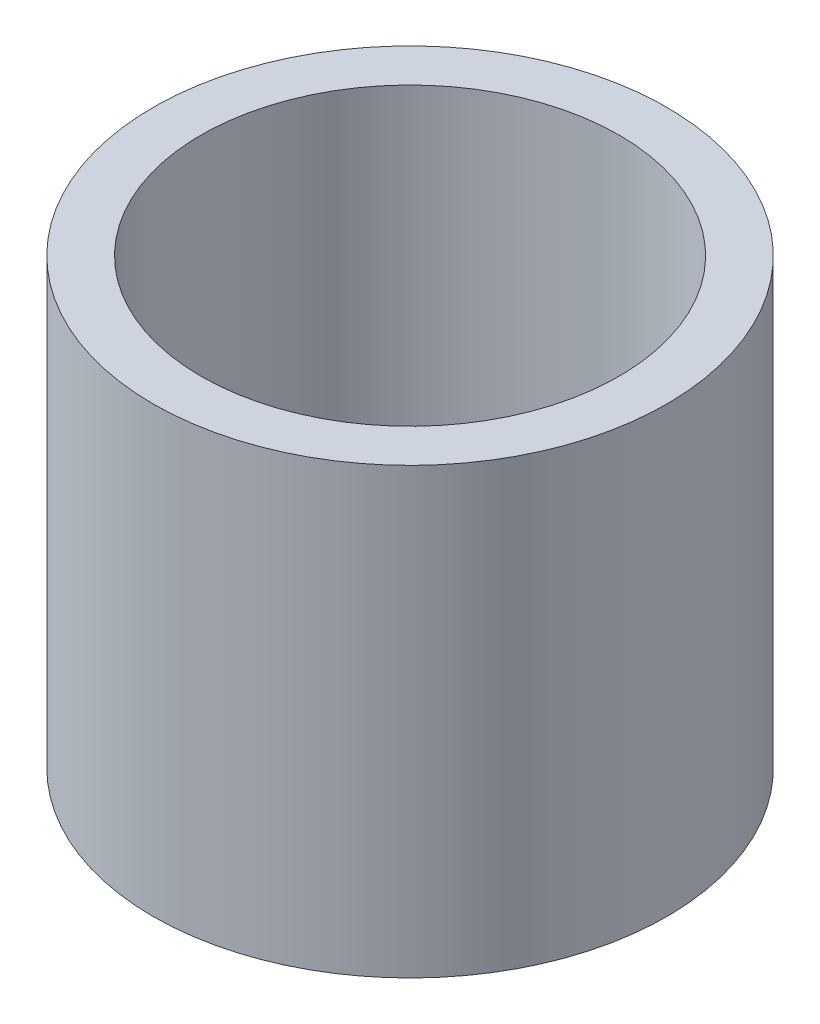
from build123d import *

# Parameters (mm, degrees)
SKETCH1_R           = 20
BOSS_EXTRUDE1_DEPTH = 34.565214937
SKETCH2_R           = 16.273210482
CUT_EXTRUDE1_DEPTH  = 45.662669912


with BuildPart() as part:
    # Sketch1 → Boss-Extrude1 (new body)
    with BuildSketch(Plane(origin=(0, 0, 0), x_dir=(1, 0, 0), z_dir=(0, 1, 0))):
        Circle(SKETCH1_R)
    extrude(amount=BOSS_EXTRUDE1_DEPTH)

    # Sketch2 → Cut-Extrude1 (cut, through all)
    with BuildSketch(Plane(origin=(0, 0, 0), x_dir=(1, 0, 0), z_dir=(0, 1, 0))):
        Circle(SKETCH2_R)
    extrude(amount=CUT_EXTRUDE1_DEPTH, mode=Mode.SUBTRACT)


solid = part.part
